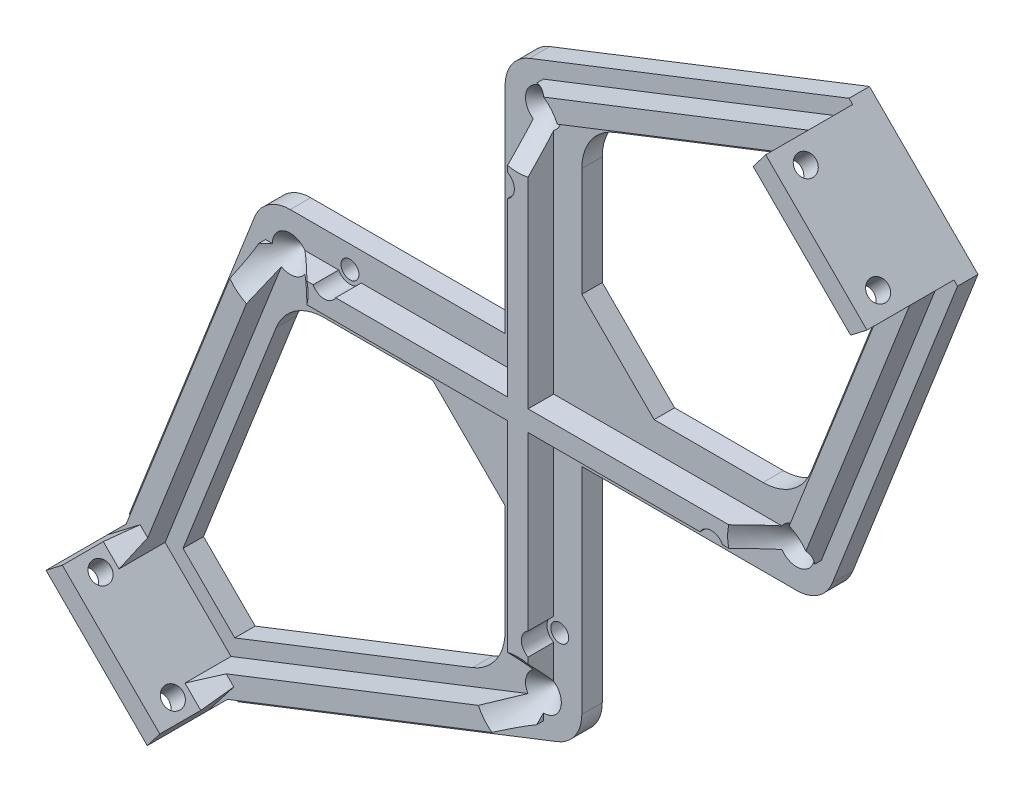
from build123d import *

# Parameters (mm, degrees)
SKETCH2_R           = 0.5
SKETCH2_R_2         = 0.49999999999999917
SKETCH2_R_3         = 0.5000000000000001
BOSS_EXTRUDE1_DEPTH = 4
CHAMFER1_SIZE       = 3
BOSS_EXTRUDE2_DEPTH = 4
FILLET1_R           = 10
BOSS_EXTRUDE4_DEPTH = 5
CHAMFER2_SIZE       = 5
BOSS_EXTRUDE5_DEPTH = 12
CHAMFER3_SIZE       = 4
SKETCH7_R           = 1.9999999999999967
CUT_EXTRUDE1_DEPTH  = 197.57038973194156
SKETCH8_R           = 1.7500000000000013
SKETCH8_R_2         = 1.7500000000000038
SKETCH8_R_3         = 1.7499999999999993
CUT_EXTRUDE2_DEPTH  = 10
CUT_EXTRUDE3_START  = -4
SKETCH9_R           = 2.5000000000000027
SKETCH9_R_2         = 2.5000000000000018
SKETCH9_R_3         = 2.5
CUT_EXTRUDE3_DEPTH  = 10
BOSS_EXTRUDE6_DEPTH = 4


with BuildPart() as part:
    # Sketch2 → Boss-Extrude1 (new body)
    with BuildSketch(Plane(origin=(-1.25e-15, -1.7e-16, -75.99999999999999), x_dir=(-1, 0, 2e-17), z_dir=(-2e-17, 0, -1))):
        with BuildLine():
            Line((-7.5, 42.00000000000002), (-7.5, -2.45e-15))
            ThreePointArc((-7.5, -2.45e-15), (1e-16, -7.5), (7.5, -1.8e-15))
            Line((7.5, 1.12e-15), (7.5, 41.999999999999964))
            Line((7.5, 41.999999999999964), (49.50000000000001, 41.99999999999978))
            ThreePointArc((49.50000000000001, 41.99999999999978), (57.0000000000001, 49.49999999999975), (49.50000000000007, 56.99999999999978))
            Line((49.500000000000064, 56.99999999999979), (7.5, 56.99999999999995))
            Line((7.5, 56.99999999999995), (7.499999999999976, 99.00000000000001))
            ThreePointArc((7.499999999999975, 99.00000000000001), (-2.319e-14, 106.5), (-7.500000000000025, 99.00000000000001))
            Line((-7.500000000000024, 99.00000000000001), (-7.500000000000015, 57.000000000000014))
            Line((-7.5, 57.000000000000014), (-49.49999999999994, 57.00000000000019))
            ThreePointArc((-49.49999999999994, 57.00000000000019), (-57.000000000000064, 49.50000000000023), (-49.49999999999999, 42.000000000000206))
            Line((-49.49999999999999, 42.0000000000002), (-7.5, 42.00000000000002))
        make_face()
        Circle(SKETCH2_R, mode=Mode.SUBTRACT)
        with Locations((49.5, 49.49999999999988)):
            Circle(SKETCH2_R_2, mode=Mode.SUBTRACT)
        with Locations((-49.5, 49.50000000000013)):
            Circle(SKETCH2_R_2, mode=Mode.SUBTRACT)
        with Locations((-2.352e-14, 99)):
            Circle(SKETCH2_R_3, mode=Mode.SUBTRACT)
    extrude(amount=BOSS_EXTRUDE1_DEPTH)

    # Chamfer1
    chamfer1_edges = [part.edges().sort_by_distance(p)[0] for p in [
        (0.49999999999999867, -1.1e-16, -75.99999999999999),
        (-49, 49.49999999999988, -75.99999999999999),
        (0.5000000000000224, 99, -75.99999999999999),
        (50, 49.50000000000013, -75.99999999999999),
    ]]
    chamfer(chamfer1_edges, length=CHAMFER1_SIZE)

    # Sketch3 → Boss-Extrude2 (add)
    with BuildSketch(Plane(origin=(0, 0, -79.99999999999999), x_dir=(-1, 0, 0), z_dir=(0, 0, -1))):
        Polygon((56.48320781823236, 52.235837818178865), (80.96372644585969, -10.250523010263308), (70.35712472806149, -20.85712472806152), (65.40737725975566, -15.907377259755682), (70.46028645315, -10.854468066361337), (49.7516366918705, 42.004222590330855), align=None)
    extrude(amount=-BOSS_EXTRUDE2_DEPTH)

    # Fillet1
    fillet1_edges = [part.edges().sort_by_distance(p)[0] for p in [
        (-49.7516366918705, 42.004222590330855, -77.99999999999999),
    ]]
    fillet(fillet1_edges, radius=FILLET1_R)

    # Sketch5 → Boss-Extrude4 (add)
    with BuildSketch(Plane.XY.offset(-75.99999999999999)):
        with BuildLine():
            Line((0, 49.49999999999989), (-2.0000000000000018, 51.49999999999989))
            Line((-2.0000000000000018, 51.49999999999989), (-46.62771867673098, 51.499999999999886))
            ThreePointArc((-46.62771867673098, 51.499999999999886), (-45.999999999999986, 49.499999999999886), (-46.627718676730964, 47.499999999999886))
            Line((-46.627718676730964, 47.499999999999886), (-1.9999999999999982, 47.499999999999886))
            Line((-1.9999999999999982, 47.499999999999886), (0, 49.49999999999989))
        make_face()
        with BuildLine():
            Line((-54.33302242729803, 49.49999999999989), (-76.5772611619678, -7.2782712887445))
            Line((-76.5772611619678, -7.2782712887445), (-80.25661966467315, -10.957629791449861))
            Line((-80.25661966467315, -10.957629791449861), (-78.64868432735105, -12.56556512877197))
            Line((-78.64868432735105, -12.56556512877197), (-70.35712472806149, -20.85712472806152))
            Line((-70.35712472806149, -20.85712472806152), (-67.5286976033153, -18.028697603315333))
            Line((-67.5286976033153, -18.028697603315333), (-73.96959982780758, -11.587795378823028))
            Line((-73.96959982780758, -11.587795378823028), (-51.229176548510004, 46.45698365694761))
            ThreePointArc((-51.229176548510004, 46.45698365694761), (-52.525071728057476, 47.73961906392169), (-53.00000000000002, 49.4999999999999))
            Line((-53.00000000000002, 49.4999999999999), (-54.33302242729803, 49.49999999999989))
        make_face()
    extrude(amount=BOSS_EXTRUDE4_DEPTH)

    # Chamfer2
    chamfer2_edges = [part.edges().sort_by_distance(p)[0] for p in [
        (-45.999999999999986, 49.499999999999886, -70.99999999999999),
        (-52.525071728057476, 47.73961906392169, -70.99999999999999),
    ]]
    chamfer(chamfer2_edges, length=CHAMFER2_SIZE - 0.0001)  # a hair under: the kernel refuses the full size

    # Mirror2: part across plane


with BuildPart() as part_1:
    add(part.part)
    add(part.part.mirror(Plane(origin=(-70.35712472806149, -20.85712472806152, 3.478146182439232), x_dir=(0, 0, 1), z_dir=(0.7071067811865482, -0.7071067811865468, 0))))

    # Sketch6 → Boss-Extrude5 (add)
    with BuildSketch(Plane.XY.offset(-70.99999999999999)):
        Polygon((-80.25661966467315, -10.957629791449861), (-60.45762979144981, -30.75661966467317), (-58.00107255414479, -27.5563226524858), (-77.05632265248579, -8.501072554144805), align=None)
    extrude(amount=BOSS_EXTRUDE5_DEPTH)

    # Chamfer3
    chamfer3_edges = [part_1.edges().sort_by_distance(p)[0] for p in [
        (-59.54443396648389, -26.012961240146698, -70.99999999999999),
        (-75.51296124014668, -10.044433966483911, -70.99999999999999),
    ]]
    chamfer(chamfer3_edges, length=CHAMFER3_SIZE)

    # Sketch7 → Cut-Extrude1 (cut, through all)
    with BuildSketch(Plane(origin=(-42.77869760331542, -42.7786976033153, 0), x_dir=(0, 0, -1), z_dir=(0.7071067811865475, 0.7071067811865477, 0))):
        with Locations(Location((63.99999999999996, 45.00178566873401, 0), (0, 0, 90))):
            Circle(SKETCH7_R)
        with Locations(Location((63.99999999999996, 25.001785668734005, 0), (0, 0, 90))):
            Circle(SKETCH7_R)
    extrude(amount=-CUT_EXTRUDE1_DEPTH, mode=Mode.SUBTRACT)

    # Mirror3: part across plane


with BuildPart() as part_2:
    add(part_1.part)
    add(part_1.part.mirror(Plane(origin=(0, 49.49999999999989, -70.99999999999999), x_dir=(0, 0, 1), z_dir=(-0.7071067811865476, -0.7071067811865476, 0))))

    # Sketch8 → Cut-Extrude2 (cut)
    with BuildSketch(Plane(origin=(0, 0, -79.99999999999999), x_dir=(-1, 0, 0), z_dir=(0, 0, -1))):
        with Locations((3.1819805153394918, 87.33021279348041)):
            Circle(SKETCH8_R)
        with Locations((37.83021279348029, 52.68198051533957)):
            Circle(SKETCH8_R_2)
        with Locations((-3.1819805153395033, 11.669787206519844)):
            Circle(SKETCH8_R_3)
        with Locations((-37.83021279348031, 46.31801948466069)):
            Circle(SKETCH8_R_2)
    extrude(amount=-CUT_EXTRUDE2_DEPTH, mode=Mode.SUBTRACT)

    # Sketch9 → Cut-Extrude3 (cut)
    with BuildSketch(Plane(origin=(0, 0, -79.99999999999999), x_dir=(-1, 0, 0), z_dir=(0, 0, -1)).offset(CUT_EXTRUDE3_START)):
        with Locations((-37.83021279348031, 46.31801948466069)):
            Circle(SKETCH9_R)
        with Locations((3.1819805153394918, 87.33021279348041)):
            Circle(SKETCH9_R_2)
        with Locations((37.83021279348029, 52.68198051533957)):
            Circle(SKETCH9_R)
        with Locations((-3.1819805153395038, 11.669787206519844)):
            Circle(SKETCH9_R_3)
    extrude(amount=-CUT_EXTRUDE3_DEPTH, mode=Mode.SUBTRACT)

    # Sketch10 → Boss-Extrude6 (add)
    with BuildSketch(Plane(origin=(0, 0, -79.99999999999999), x_dir=(-1, 0, 0), z_dir=(0, 0, -1))):
        Polygon((-7.499999999999999, 71.14213562373105), (21.642135623731086, 41.99999999999998), (7.5000000000001386, 27.857864376269028), (-21.642135623730947, 57.0000000000001), align=None)
    extrude(amount=-BOSS_EXTRUDE6_DEPTH)


solid = part_2.part
